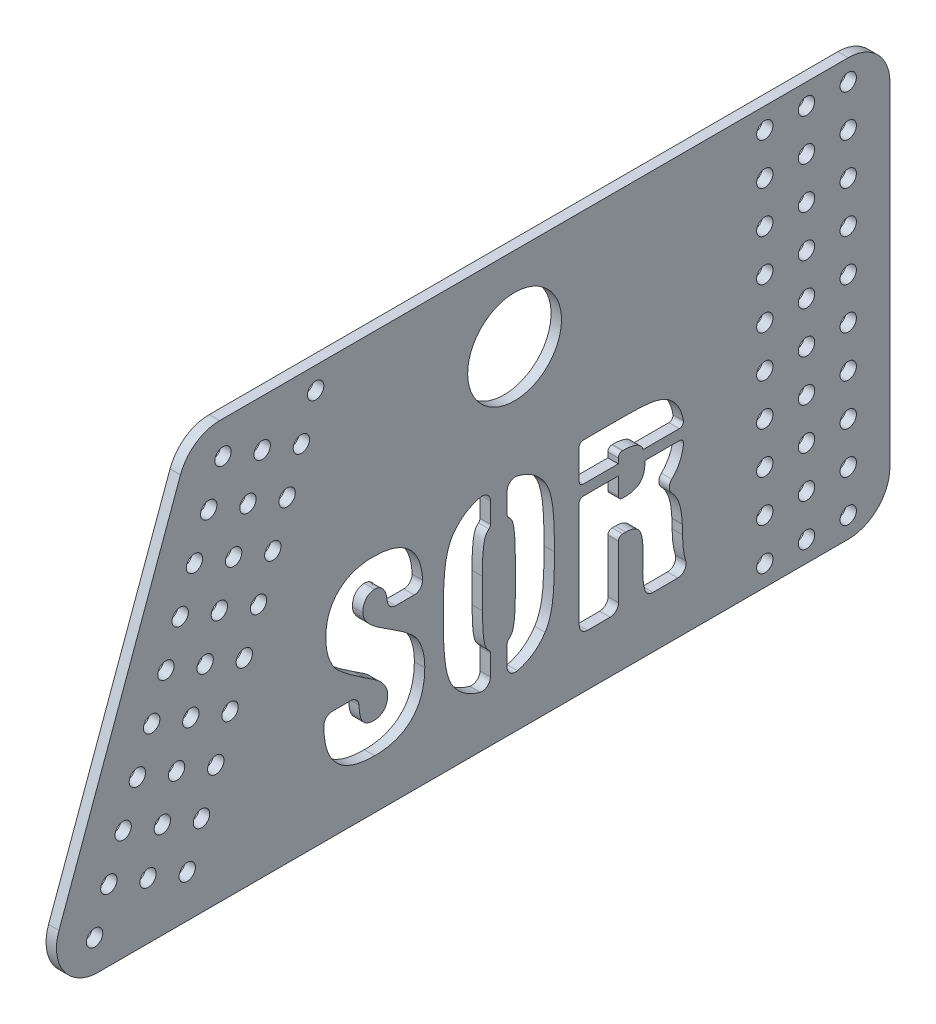
from build123d import *

# Parameters (mm, degrees)
SKETCH1_R           = 2.4892
BOSS_EXTRUDE1_DEPTH = 3.175
FILLET1_R           = 12.7
CUT_EXTRUDE3_DEPTH  = 289.68110898
FILLET2_START       = 17
FILLET2_OUTLINE_R   = 14.2875
FILLET2_DEPTH       = 5
FILLET2_START_2     = 17.71343226
FILLET2_2_DEPTH     = 3.175
FILLET3_R           = 1.27


with BuildPart() as part:
    # Sketch1 → Boss-Extrude1 (new body)
    with BuildSketch(Plane(origin=(17.71343226, 0, 0), x_dir=(0, 0, -1), z_dir=(1, 0, 0))):
        Polygon((46.224219752, 127), (0, 0), (259.225195644, 0), (259.225195644, 127), align=None)
        with Locations((17.043593575, 9.694572611)):
            Circle(SKETCH1_R, mode=Mode.SUBTRACT)
        with Locations((21.387249395, 21.628668895)):
            Circle(SKETCH1_R, mode=Mode.SUBTRACT)
        with Locations((33.321345679, 17.285013075)):
            Circle(SKETCH1_R, mode=Mode.SUBTRACT)
        with Locations((45.255441963, 12.941357254)):
            Circle(SKETCH1_R, mode=Mode.SUBTRACT)
        with Locations((49.599097783, 24.875453538)):
            Circle(SKETCH1_R, mode=Mode.SUBTRACT)
        with Locations((25.730905215, 33.562765179)):
            Circle(SKETCH1_R, mode=Mode.SUBTRACT)
        with Locations((30.074561035, 45.496861463)):
            Circle(SKETCH1_R, mode=Mode.SUBTRACT)
        with Locations((37.665001499, 29.219109359)):
            Circle(SKETCH1_R, mode=Mode.SUBTRACT)
        with Locations((53.942753603, 36.809549822)):
            Circle(SKETCH1_R, mode=Mode.SUBTRACT)
        with Locations((42.008657319, 41.153205642)):
            Circle(SKETCH1_R, mode=Mode.SUBTRACT)
        with Locations((58.286409424, 48.743646106)):
            Circle(SKETCH1_R, mode=Mode.SUBTRACT)
        with Locations((46.35231314, 53.087301926)):
            Circle(SKETCH1_R, mode=Mode.SUBTRACT)
        with Locations((34.418216856, 57.430957747)):
            Circle(SKETCH1_R, mode=Mode.SUBTRACT)
        with Locations((62.630065244, 60.67774239)):
            Circle(SKETCH1_R, mode=Mode.SUBTRACT)
        with Locations((38.761872676, 69.365054031)):
            Circle(SKETCH1_R, mode=Mode.SUBTRACT)
        with Locations((50.69596896, 65.02139821)):
            Circle(SKETCH1_R, mode=Mode.SUBTRACT)
        with Locations((43.105528496, 81.299150315)):
            Circle(SKETCH1_R, mode=Mode.SUBTRACT)
        with Locations((55.03962478, 76.955494494)):
            Circle(SKETCH1_R, mode=Mode.SUBTRACT)
        with Locations((59.3832806, 88.889590778)):
            Circle(SKETCH1_R, mode=Mode.SUBTRACT)
        with Locations((47.449184316, 93.233246599)):
            Circle(SKETCH1_R, mode=Mode.SUBTRACT)
        with Locations((63.726936421, 100.823687062)):
            Circle(SKETCH1_R, mode=Mode.SUBTRACT)
        with Locations((66.973721064, 72.611838674)):
            Circle(SKETCH1_R, mode=Mode.SUBTRACT)
        with Locations((71.317376884, 84.545934958)):
            Circle(SKETCH1_R, mode=Mode.SUBTRACT)
        with Locations((75.661032705, 96.480031242)):
            Circle(SKETCH1_R, mode=Mode.SUBTRACT)
        with Locations((221.125195644, 6.35)):
            Circle(SKETCH1_R, mode=Mode.SUBTRACT)
        with Locations((221.125195644, 19.05)):
            Circle(SKETCH1_R, mode=Mode.SUBTRACT)
        with Locations((233.825195644, 6.35)):
            Circle(SKETCH1_R, mode=Mode.SUBTRACT)
        with Locations((246.525195644, 6.35)):
            Circle(SKETCH1_R, mode=Mode.SUBTRACT)
        with Locations((233.825195644, 19.05)):
            Circle(SKETCH1_R, mode=Mode.SUBTRACT)
        with Locations((246.525195644, 19.05)):
            Circle(SKETCH1_R, mode=Mode.SUBTRACT)
        with Locations((221.125195644, 31.75)):
            Circle(SKETCH1_R, mode=Mode.SUBTRACT)
        with Locations((221.125195644, 44.45)):
            Circle(SKETCH1_R, mode=Mode.SUBTRACT)
        with Locations((233.825195644, 31.75)):
            Circle(SKETCH1_R, mode=Mode.SUBTRACT)
        with Locations((246.525195644, 31.75)):
            Circle(SKETCH1_R, mode=Mode.SUBTRACT)
        with Locations((233.825195644, 44.45)):
            Circle(SKETCH1_R, mode=Mode.SUBTRACT)
        with Locations((246.525195644, 44.45)):
            Circle(SKETCH1_R, mode=Mode.SUBTRACT)
        with Locations((221.125195644, 57.15)):
            Circle(SKETCH1_R, mode=Mode.SUBTRACT)
        with Locations((221.125195644, 69.85)):
            Circle(SKETCH1_R, mode=Mode.SUBTRACT)
        with Locations((233.825195644, 57.15)):
            Circle(SKETCH1_R, mode=Mode.SUBTRACT)
        with Locations((246.525195644, 57.15)):
            Circle(SKETCH1_R, mode=Mode.SUBTRACT)
        with Locations((233.825195644, 69.85)):
            Circle(SKETCH1_R, mode=Mode.SUBTRACT)
        with Locations((246.525195644, 69.85)):
            Circle(SKETCH1_R, mode=Mode.SUBTRACT)
        with Locations((221.125195644, 82.55)):
            Circle(SKETCH1_R, mode=Mode.SUBTRACT)
        with Locations((221.125195644, 95.25)):
            Circle(SKETCH1_R, mode=Mode.SUBTRACT)
        with Locations((233.825195644, 82.55)):
            Circle(SKETCH1_R, mode=Mode.SUBTRACT)
        with Locations((246.525195644, 82.55)):
            Circle(SKETCH1_R, mode=Mode.SUBTRACT)
        with Locations((233.825195644, 95.25)):
            Circle(SKETCH1_R, mode=Mode.SUBTRACT)
        with Locations((246.525195644, 95.25)):
            Circle(SKETCH1_R, mode=Mode.SUBTRACT)
        with Locations((51.792840137, 105.167342883)):
            Circle(SKETCH1_R, mode=Mode.SUBTRACT)
        with Locations((56.136495957, 117.101439167)):
            Circle(SKETCH1_R, mode=Mode.SUBTRACT)
        with Locations((68.070592241, 112.757783346)):
            Circle(SKETCH1_R, mode=Mode.SUBTRACT)
        with Locations((80.004688525, 108.414127526)):
            Circle(SKETCH1_R, mode=Mode.SUBTRACT)
        with Locations((84.348344345, 120.34822381)):
            Circle(SKETCH1_R, mode=Mode.SUBTRACT)
        with Locations((221.125195644, 107.95)):
            Circle(SKETCH1_R, mode=Mode.SUBTRACT)
        with Locations((221.125195644, 120.65)):
            Circle(SKETCH1_R, mode=Mode.SUBTRACT)
        with Locations((233.825195644, 107.95)):
            Circle(SKETCH1_R, mode=Mode.SUBTRACT)
        with Locations((246.525195644, 107.95)):
            Circle(SKETCH1_R, mode=Mode.SUBTRACT)
        with Locations((233.825195644, 120.65)):
            Circle(SKETCH1_R, mode=Mode.SUBTRACT)
        with Locations((246.525195644, 120.65)):
            Circle(SKETCH1_R, mode=Mode.SUBTRACT)
    extrude(amount=BOSS_EXTRUDE1_DEPTH)

    # Fillet1
    fillet1_edges = [part.edges().sort_by_distance(p)[0] for p in [
        (19.30093226, 0, -259.225195644),
        (19.30093226, 0, 0),
        (19.30093226, 127, -46.224219752),
        (19.30093226, 127, -259.225195644),
    ]]
    fillet(fillet1_edges, radius=FILLET1_R)

    # Sketch4 → Cut-Extrude3 (cut, through all)
    with BuildSketch(Plane.ZY.offset(-17.71343226)):
        with BuildLine():
            add(Edge.make_bspline(
                [(-102.346531748, 15.017852494), (-101.137761454, 15.009990472), (-99.374464661, 15.117696089), (-97.1266748, 15.528842731), (-95.606811505, 15.942503702), (-94.208407658, 16.49255363), (-92.922065326, 17.152816005), (-91.76611475, 17.953443404), (-90.728299578, 18.868938072), (-89.803929038, 19.901976312), (-89.022414939, 21.067741638), (-88.342858722, 22.340057391), (-87.810011199, 23.738015888), (-87.382607526, 25.248755736), (-86.969843115, 27.487068323), (-86.851218194, 29.24222061), (-86.856637214, 30.444948203)],
                knots=[0, 0, 0, 0, 0.144706603, 0.210732583, 0.273247813, 0.332929474, 0.390291493, 0.445929998, 0.500771491, 0.555612984, 0.611353057, 0.668368911, 0.727908241, 0.790046978, 0.856072958, 1, 1, 1, 1], degree=3))
            add(Edge.make_bspline(
                [(-86.856637214, 30.444948203), (-86.850277593, 30.784807967), (-86.860814621, 31.228846126), (-86.870633478, 31.801094773), (-86.925686599, 32.371628198), (-86.936455989, 32.840101462), (-86.969542836, 33.179173546)],
                knots=[0, 0, 0, 0, 0.372291137, 0.486887781, 0.626896694, 1, 1, 1, 1], degree=3))
            Line((-86.969542836, 33.179173546), (-97.513663145, 33.197248797))
            Line((-97.513663145, 33.197248797), (-97.516115735, 31.766541022))
            add(Edge.make_bspline(
                [(-97.516115735, 31.766541022), (-97.518703085, 31.141877778), (-97.553412891, 30.242586883), (-97.653779838, 29.094530251), (-97.781864596, 28.348508983), (-97.90450162, 27.668177474), (-98.102879225, 27.071449283), (-98.298940533, 26.536348737), (-98.624339582, 25.942049729), (-99.139689425, 25.316707469), (-100.282944801, 24.567304596), (-101.349541392, 24.43603042), (-102.056022818, 24.424775719)],
                knots=[0, 0, 0, 0, 0.189473721, 0.273111235, 0.349375655, 0.419162021, 0.48249029, 0.539920022, 0.591813841, 0.687504397, 0.782623415, 1, 1, 1, 1], degree=3))
            add(Edge.make_bspline(
                [(-102.056022818, 24.424775719), (-102.653560847, 24.425432252), (-103.541158477, 24.557505805), (-104.563566575, 25.107854352), (-105.187521658, 25.670442659), (-105.690365722, 26.365695614), (-106.196679819, 27.502959934), (-106.303309834, 28.469693053), (-106.300902157, 29.125963718)],
                knots=[0, 0, 0, 0, 0.251446371, 0.366612785, 0.482014955, 0.600589513, 0.723754341, 1, 1, 1, 1], degree=3))
            add(Edge.make_bspline(
                [(-106.300902157, 29.125963718), (-106.31327283, 29.73434108), (-106.111599903, 30.653013303), (-105.560384679, 31.801651052), (-104.982263104, 32.674332259), (-104.224468554, 33.520330627), (-102.951996407, 34.702651096), (-101.829150462, 35.477149524), (-101.026882379, 35.976500714)],
                knots=[0, 0, 0, 0, 0.201131267, 0.308106748, 0.422671857, 0.548244122, 0.685138631, 1, 1, 1, 1], degree=3))
            add(Edge.make_bspline(
                [(-101.026882379, 35.976500714), (-100.382721085, 36.426731384), (-99.712288751, 36.836594118)],
                knots=[0, 0, 0, 1, 1, 1], degree=2))
            add(Edge.make_bspline(
                [(-99.712288751, 36.836594118), (-99.421578607, 37.007529941), (-99.143303842, 37.19819643)],
                knots=[0, 0, 0, 1, 1, 1], degree=2))
            add(Edge.make_bspline(
                [(-99.143303842, 37.19819643), (-98.02634731, 37.917546811), (-96.459324724, 38.994367569), (-94.496194334, 40.398978438), (-93.280265294, 41.34075421), (-92.227480657, 42.195382991), (-91.139681231, 43.164971045), (-90.439481771, 43.888639151), (-90.076340575, 44.385210274)],
                knots=[0, 0, 0, 0, 0.343185346, 0.491233736, 0.623581222, 0.740501597, 0.841497893, 1, 1, 1, 1], degree=3))
            add(Edge.make_bspline(
                [(-90.076340575, 44.385210274), (-89.645084495, 45.001125589), (-89.077498156, 45.988251431), (-88.475097151, 47.39365682), (-88.101922741, 48.514339009), (-87.804372631, 49.689122272), (-87.527205457, 51.360362924), (-87.439276662, 52.648633655), (-87.444236178, 53.523535699)],
                knots=[0, 0, 0, 0, 0.23336578, 0.352452206, 0.474357131, 0.59983969, 0.728425053, 1, 1, 1, 1], degree=3))
            add(Edge.make_bspline(
                [(-87.444236178, 53.523535699), (-87.43140053, 54.570872505), (-87.558921522, 56.102940046), (-87.945368253, 58.070314371), (-88.368953671, 59.41885791), (-88.903618876, 60.685028319), (-89.571901763, 61.852805259), (-90.352509885, 62.937175762), (-91.250275623, 63.926219676), (-92.259482183, 64.810650193), (-93.365490302, 65.578712543), (-94.553878491, 66.246911322), (-95.843151701, 66.771408062), (-97.216236789, 67.190101773), (-99.215900094, 67.589628065), (-100.779482055, 67.697129642), (-101.844649221, 67.698551029)],
                knots=[0, 0, 0, 0, 0.137036202, 0.200811447, 0.26225021, 0.321860438, 0.380504602, 0.438104572, 0.496561124, 0.555086537, 0.613485121, 0.672665356, 0.733292709, 0.795423374, 0.860456494, 1, 1, 1, 1], degree=3))
            add(Edge.make_bspline(
                [(-101.844649221, 67.698551029), (-102.99721851, 67.698535447), (-104.682473904, 67.604476919), (-106.835661346, 67.204803551), (-108.298380806, 66.800851704), (-109.652713032, 66.271806446), (-110.897263041, 65.625523019), (-112.033822811, 64.859007473), (-113.058420384, 63.975998143), (-113.968063775, 62.980839357), (-114.7588024, 61.876553797), (-115.426402063, 60.665597224), (-115.982307468, 59.354625781), (-116.405426951, 57.935247839), (-116.800659766, 55.842151404), (-116.929754633, 54.205987194), (-116.921576005, 53.084097351)],
                knots=[0, 0, 0, 0, 0.144329262, 0.210477526, 0.27376446, 0.333965646, 0.39211498, 0.448922421, 0.505148783, 0.561000861, 0.617268822, 0.674725679, 0.733721037, 0.795158799, 0.859700873, 1, 1, 1, 1], degree=3))
            add(Edge.make_bspline(
                [(-116.921576005, 53.084097351), (-116.924223152, 52.805750917), (-116.874198524, 52.251737781), (-116.862643079, 51.695787439), (-116.855836182, 51.418087147)],
                knots=[0, 0, 0, 0, 0.500152825, 1, 1, 1, 1], degree=3))
            Line((-116.855836182, 51.418087147), (-106.262719031, 51.399927904))
            Line((-106.262719031, 51.399927904), (-106.261627124, 52.036886844))
            add(Edge.make_bspline(
                [(-106.261627124, 52.036886844), (-106.272938869, 53.034959826), (-106.165304258, 54.4455779), (-105.735577795, 56.160455263), (-105.292743149, 57.152021009), (-104.731481922, 57.938536315), (-103.80710129, 58.713452985), (-102.916022676, 58.933951856), (-102.33007041, 58.919123348)],
                knots=[0, 0, 0, 0, 0.338075787, 0.476571748, 0.596906439, 0.70380763, 0.801284768, 1, 1, 1, 1], degree=3))
            add(Edge.make_bspline(
                [(-102.33007041, 58.919123348), (-101.829228288, 58.91602755), (-101.0766223, 58.780935321), (-100.224872779, 58.252454139), (-99.69076936, 57.720027131), (-99.256184908, 57.06227906), (-98.82557709, 56.00639931), (-98.726094574, 55.123361987), (-98.731428624, 54.522824471)],
                knots=[0, 0, 0, 0, 0.236687534, 0.34842468, 0.466860105, 0.588743967, 0.716870172, 1, 1, 1, 1], degree=3))
            add(Edge.make_bspline(
                [(-98.731428624, 54.522824471), (-98.727994288, 53.95374318), (-98.94822206, 53.083351344), (-99.550197411, 52.001121159), (-100.190143623, 51.148533103), (-100.998027468, 50.27444182), (-102.415651738, 49.056826954), (-103.617067639, 48.204609416), (-104.495433617, 47.663328035)],
                knots=[0, 0, 0, 0, 0.182289154, 0.284139561, 0.397956908, 0.525486442, 0.667349445, 1, 1, 1, 1], degree=3))
            add(Edge.make_bspline(
                [(-104.495433617, 47.663328035), (-104.799813267, 47.451733387), (-105.350939129, 47.122460298), (-105.874612504, 46.751439244), (-106.104344265, 46.607751221)],
                knots=[0, 0, 0, 0, 0.577693413, 1, 1, 1, 1], degree=3))
            add(Edge.make_bspline(
                [(-106.104344265, 46.607751221), (-106.760254865, 46.223456768), (-107.389455795, 45.796604262)],
                knots=[0, 0, 0, 1, 1, 1], degree=2))
            add(Edge.make_bspline(
                [(-107.389455795, 45.796604262), (-108.346725757, 45.201275361), (-109.703619472, 44.31047015), (-111.393959277, 43.107292253), (-112.449588017, 42.261805131), (-113.383644145, 41.473966654), (-114.367063078, 40.512703342), (-115.014104016, 39.787390642), (-115.338148772, 39.274032428)],
                knots=[0, 0, 0, 0, 0.326827235, 0.470629277, 0.601394131, 0.718923834, 0.824753266, 1, 1, 1, 1], degree=3))
            add(Edge.make_bspline(
                [(-115.338148772, 39.274032428), (-115.706092343, 38.686367366), (-116.192760735, 37.752942834), (-116.70538865, 36.425944857), (-117.012653825, 35.358730514), (-117.274733926, 34.245470648), (-117.51192481, 32.664814674), (-117.582794216, 31.450068901), (-117.587237877, 30.625020275)],
                knots=[0, 0, 0, 0, 0.229662467, 0.347870699, 0.470840235, 0.597411334, 0.726621142, 1, 1, 1, 1], degree=3))
            add(Edge.make_bspline(
                [(-117.587237877, 30.625020275), (-117.592435155, 29.445933011), (-117.490650914, 27.716686691), (-117.066544357, 25.512127044), (-116.639479334, 24.006566878), (-116.081218972, 22.611357603), (-115.410594631, 21.316099316), (-114.597816254, 20.137572604), (-113.668698852, 19.06871301), (-112.627254207, 18.10594707), (-111.465523195, 17.28223145), (-110.204762441, 16.580571453), (-108.839465748, 16.005120514), (-107.36441651, 15.564202465), (-105.198160865, 15.139696248), (-103.504528459, 15.006275151), (-102.346531748, 15.017852494)],
                knots=[0, 0, 0, 0, 0.142387442, 0.20826911, 0.270660411, 0.330990701, 0.3893684, 0.446348619, 0.503357479, 0.560009359, 0.617119025, 0.67483118, 0.733852434, 0.795598798, 0.86031991, 1, 1, 1, 1], degree=3))
        make_face()
        with BuildLine():
            add(Edge.make_bspline(
                [(-135.137111808, 36.827482877), (-135.138911136, 35.585710284), (-135.177577725, 33.818356076), (-135.274659936, 31.589080402), (-135.412960716, 30.208411693), (-135.549858935, 29.01602692), (-135.738543858, 28.015364231), (-135.942327716, 27.197346068), (-136.201862948, 26.54847353), (-136.52249732, 26.041175054), (-136.877189591, 25.610100095), (-137.242131867, 25.30273949), (-137.485464149, 25.140626536), (-137.580645931, 25.083265084)],
                knots=[0, 0, 0, 0, 0.246099497, 0.350474793, 0.442158792, 0.52110539, 0.588285913, 0.643883824, 0.688013345, 0.726105642, 0.762417351, 0.798234999, 0.820247331, 0.820247331, 0.820247331, 0.820247331], degree=3))
            Line((-137.580645931, 25.083265084), (-137.580645931, 15.169480081))
            add(Edge.make_bspline(
                [(-137.580645931, 15.16948008), (-136.925112896, 15.237183354), (-135.582639213, 15.434461701), (-133.617682661, 15.896270515), (-131.755507316, 16.615084184), (-130.063737661, 17.541838734), (-128.027038904, 19.071938936), (-126.764482306, 20.524062042), (-126.069386172, 21.593474816)],
                knots=[0.160645262, 0.160645262, 0.160645262, 0.160645262, 0.282125908, 0.410512069, 0.531963987, 0.648948724, 0.765055946, 1, 1, 1, 1], degree=3))
            add(Edge.make_bspline(
                [(-126.069386172, 21.593474816), (-125.49783603, 22.458096729), (-124.85997275, 23.973989075), (-124.23671347, 26.194185514), (-123.927268025, 27.818725075), (-123.718473589, 29.279012914), (-123.599078976, 30.554958284), (-123.470314539, 31.981271219), (-123.391284792, 33.563526449), (-123.301892709, 35.297354206), (-123.238274495, 37.914138942), (-123.214028109, 39.952499361), (-123.213268603, 41.363762096)],
                knots=[0, 0, 0, 0, 0.153165915, 0.242870067, 0.342209598, 0.398542505, 0.461930228, 0.532521544, 0.611241583, 0.697205761, 0.790391521, 1, 1, 1, 1], degree=3))
            add(Edge.make_bspline(
                [(-123.213268603, 41.363762096), (-123.209232207, 42.775016696), (-123.226371267, 44.813455074), (-123.28119123, 47.430432575), (-123.36406097, 49.161323089), (-123.439042733, 50.743754382), (-123.561657242, 52.170573696), (-123.67614615, 53.447040249), (-123.883077862, 54.90754049), (-124.183034181, 56.533805682), (-124.800777183, 58.759002908), (-125.432819651, 60.277181197), (-126.001587185, 61.143725346)],
                knots=[0, 0, 0, 0, 0.20960954, 0.302795771, 0.388760385, 0.466996393, 0.538071606, 0.601459649, 0.657312329, 0.757128703, 0.84683331, 1, 1, 1, 1], degree=3))
            add(Edge.make_bspline(
                [(-126.001587185, 61.143725346), (-126.694287438, 62.219759114), (-127.945575146, 63.689270023), (-129.979905901, 65.229057536), (-131.671090664, 66.152648427), (-133.533917697, 66.861050436), (-135.520514738, 67.358188126), (-136.894708397, 67.551630609), (-137.580645931, 67.617547346)],
                knots=[0, 0, 0, 0, 0.235743144, 0.351796653, 0.468437187, 0.589616336, 0.718088431, 0.844990788, 0.844990788, 0.844990788, 0.844990788], degree=3))
            Line((-137.580645931, 67.617547346), (-137.580645931, 57.75293648))
            Line((-137.580645931, 57.75293648), (-137.580645931, 57.747988238))
            add(Edge.make_bspline(
                [(-137.580645931, 57.747988238), (-137.462455054, 57.680661445), (-137.195029858, 57.510173458), (-136.817398976, 57.183369592), (-136.458310187, 56.765123611), (-136.153238779, 56.25957781), (-135.8921474, 55.623772935), (-135.692966662, 54.813644099), (-135.505381838, 53.816160553), (-135.375066925, 52.619551665), (-135.240900608, 51.228747564), (-135.151386984, 48.979517719), (-135.119142331, 47.195737504), (-135.121489147, 45.940895413)],
                knots=[0.172928377, 0.172928377, 0.172928377, 0.172928377, 0.199876863, 0.235721816, 0.27156677, 0.308796515, 0.352361395, 0.407375581, 0.473970392, 0.553620279, 0.646019442, 0.7511215, 1, 1, 1, 1], degree=3))
            Line((-135.121489147, 45.940895413), (-135.137111808, 36.827482877))
        make_face()
        with BuildLine():
            add(Edge.make_bspline(
                [(-142.660656289, 25.014245558), (-142.793326062, 25.088372236), (-143.073107477, 25.265224404), (-143.469229479, 25.591831868), (-143.824416544, 26.011278135), (-144.130839945, 26.515846915), (-144.388813751, 27.153582898), (-144.605674121, 27.963134837), (-144.78430421, 28.966857287), (-144.922495914, 30.165260027), (-145.035071959, 31.557844925), (-145.156150132, 33.804996532), (-145.165571531, 35.590367409), (-145.171664965, 36.844684602)],
                knots=[0.168940196, 0.168940196, 0.168940196, 0.168940196, 0.199078, 0.234523767, 0.270388048, 0.307637868, 0.351226239, 0.406441644, 0.473709631, 0.553402467, 0.6457946, 0.750987302, 1, 1, 1, 1], degree=3))
            Line((-145.171664965, 36.844684602), (-145.156042304, 45.958097138))
            add(Edge.make_bspline(
                [(-145.156042304, 45.958097138), (-145.144616681, 47.225339112), (-145.131730536, 49.02728688), (-144.999637708, 51.293214328), (-144.88880394, 52.693215429), (-144.728478904, 53.89239752), (-144.552063835, 54.893838397), (-144.329200397, 55.695102291), (-144.072241348, 56.326265387), (-143.751065174, 56.814405215), (-143.392296647, 57.224638456), (-143.02365539, 57.53285447), (-142.767249036, 57.689544226), (-142.660656289, 57.747619787)],
                knots=[0, 0, 0, 0, 0.251020298, 0.356614174, 0.449435963, 0.529024965, 0.596136496, 0.65060096, 0.693492176, 0.730452155, 0.765744421, 0.801107745, 0.825115342, 0.825115342, 0.825115342, 0.825115342], degree=3))
            Line((-142.660656289, 57.747619787), (-142.660656289, 57.752567994))
            Line((-142.660656289, 57.752567994), (-142.660656289, 67.623818278))
            add(Edge.make_bspline(
                [(-142.660656289, 67.623818278), (-143.340702931, 67.560948326), (-144.70322248, 67.374742657), (-146.672265396, 66.883465753), (-148.518041503, 66.181421509), (-150.193222169, 65.263601215), (-152.210834134, 63.723856064), (-153.45789011, 62.262275201), (-154.155172361, 61.191987609)],
                knots=[0.157908832, 0.157908832, 0.157908832, 0.157908832, 0.284112286, 0.411868146, 0.532349162, 0.648344483, 0.763846436, 1, 1, 1, 1], degree=3))
            add(Edge.make_bspline(
                [(-154.155172361, 61.191987609), (-154.739425945, 60.316993198), (-155.421016847, 58.799318782), (-156.059552589, 56.560159652), (-156.363444147, 54.933785982), (-156.575739732, 53.474052416), (-156.693932274, 52.201192054), (-156.822522337, 50.778161651), (-156.902277702, 49.199207726), (-156.991239466, 47.468624174), (-157.054756434, 44.858375054), (-157.079209413, 42.826548667), (-157.079885509, 41.421817919)],
                knots=[0, 0, 0, 0, 0.155519152, 0.245246631, 0.344941287, 0.400725859, 0.464036605, 0.534542197, 0.612682802, 0.698542588, 0.791615186, 1, 1, 1, 1], degree=3))
            add(Edge.make_bspline(
                [(-157.079885509, 41.421817919), (-157.083874365, 40.020360601), (-157.066626825, 37.994992158), (-157.011983508, 35.394336671), (-156.928632499, 33.670005974), (-156.854516467, 32.094053433), (-156.731040207, 30.67055067), (-156.61607481, 29.394201169), (-156.41150378, 27.930044855), (-156.107703619, 26.294170043), (-155.486881562, 24.043488171), (-154.802629175, 22.519167985), (-154.222971349, 21.641737079)],
                knots=[0, 0, 0, 0, 0.207908774, 0.300500752, 0.385879955, 0.464023771, 0.53453226, 0.597845608, 0.654112418, 0.75381117, 0.844474458, 1, 1, 1, 1], degree=3))
            add(Edge.make_bspline(
                [(-154.222971349, 21.641737079), (-153.549202365, 20.563895586), (-152.297141864, 19.120243227), (-150.289403311, 17.570726281), (-148.60230986, 16.644758686), (-146.749172277, 15.921341504), (-144.746336762, 15.43957588), (-143.363790984, 15.226776331), (-142.660656289, 15.154146904)],
                knots=[0, 0, 0, 0, 0.234552485, 0.350071381, 0.467433479, 0.589277168, 0.716904566, 0.84765444, 0.84765444, 0.84765444, 0.84765444], degree=3))
            Line((-142.660656289, 15.154146904), (-142.660656289, 25.014245558))
        make_face()
        with BuildLine():
            add(Edge.make_bspline(
                [(-177.963828927, 57.729411488), (-177.72790771, 57.729645213), (-177.239603212, 57.677746875), (-176.74884757, 57.665766191), (-176.494041269, 57.658296126)],
                knots=[0, 0, 0, 0, 0.480233968, 1, 1, 1, 1], degree=3))
            Line((-176.494041269, 57.658296126), (-176.498764486, 54.903027551))
            Line((-176.498764486, 54.903027551), (-164.582697595, 54.903027551))
            Line((-164.582697595, 54.903027551), (-164.572351082, 66.486714972))
            Line((-164.572351082, 66.486714972), (-177.987974891, 66.509712695))
            add(Edge.make_bspline(
                [(-177.987974891, 66.509712695), (-179.000647169, 66.511126573), (-180.46461378, 66.498514527), (-182.342806279, 66.434170672), (-183.584693069, 66.370907606), (-184.714596429, 66.28015439), (-185.732700742, 66.19324181), (-186.637944907, 66.065130684), (-187.676396863, 65.877353957), (-188.845024666, 65.578803882), (-190.503980558, 64.979736185), (-191.62043272, 64.334750929), (-192.260525161, 63.809947006)],
                knots=[0, 0, 0, 0, 0.205396664, 0.296881476, 0.38114652, 0.45756683, 0.526784472, 0.588339837, 0.642914613, 0.74077175, 0.832579827, 1, 1, 1, 1], degree=3))
            add(Edge.make_bspline(
                [(-192.260525161, 63.809947006), (-192.967910621, 63.224976919), (-193.916174958, 62.215461216), (-194.924447982, 60.668133656), (-195.521406307, 59.388941727), (-196.000727706, 58.005422568), (-196.331699064, 56.497481138), (-196.45640485, 55.446678295), (-196.499339595, 54.903027551)],
                knots=[0, 0, 0, 0, 0.231227889, 0.346863356, 0.464425679, 0.586358231, 0.715485013, 0.852963723, 0.852963723, 0.852963723, 0.852963723], degree=3))
            Line((-196.499339595, 54.903027551), (-184.123399875, 54.903027551))
            add(Edge.make_bspline(
                [(-184.123399875, 54.903027551), (-184.02960663, 55.130368213), (-183.852527565, 55.517580369), (-183.495565102, 55.995810545), (-183.137056234, 56.37845924), (-182.717659932, 56.706147338), (-182.229028261, 56.978745645), (-181.678609864, 57.209597114), (-181.063537087, 57.409737203), (-180.37865876, 57.54725591), (-179.341310631, 57.695163844), (-178.526708945, 57.736396317), (-177.963828927, 57.729411488)],
                knots=[0.309911832, 0.309911832, 0.309911832, 0.309911832, 0.38014834, 0.430984798, 0.479895591, 0.529804757, 0.582537959, 0.63946694, 0.700338876, 0.767231212, 0.838985026, 1, 1, 1, 1], degree=3))
        make_face()
        with BuildLine():
            Line((-164.585542878, 51.717522125), (-176.504225237, 51.717522125))
            Line((-176.504225237, 51.717522125), (-176.515308246, 45.252295836))
            add(Edge.make_bspline(
                [(-176.515308246, 45.252295836), (-176.770915336, 45.256028277), (-177.259473109, 45.206490919), (-177.750089935, 45.193598571), (-177.985331084, 45.186220042)],
                knots=[0, 0, 0, 0, 0.520157243, 1, 1, 1, 1], degree=3))
            add(Edge.make_bspline(
                [(-177.985331084, 45.186220042), (-178.550258857, 45.167387719), (-179.360700135, 45.244483855), (-180.402679908, 45.378975985), (-181.082123963, 45.550921775), (-181.704204044, 45.752085691), (-182.245812445, 46.023262758), (-182.740423162, 46.312711543), (-183.154135084, 46.674445912), (-183.514526746, 47.087820341), (-183.828568561, 47.557049699), (-184.080315247, 48.098995218), (-184.296684, 48.698505956), (-184.458925006, 49.366037407), (-184.61419945, 50.376550843), (-184.671780533, 51.168880421), (-184.657329234, 51.717522125)],
                knots=[0, 0, 0, 0, 0.155118411, 0.224207996, 0.289017523, 0.347911711, 0.403845181, 0.455536758, 0.505305623, 0.554394877, 0.606297425, 0.660219325, 0.718561151, 0.781623537, 0.849070932, 1, 1, 1, 1], degree=3))
            Line((-184.657329234, 51.717522125), (-196.527449922, 51.717522125))
            add(Edge.make_bspline(
                [(-196.527449922, 51.717522125), (-196.475201941, 50.837952617), (-196.300408407, 49.353996151), (-195.768759005, 47.352461233), (-195.089791716, 45.740569588), (-194.207755497, 44.28613323), (-192.724828253, 42.501303004), (-191.311404634, 41.429830894), (-190.291064077, 40.817185228)],
                knots=[0.098766619, 0.098766619, 0.098766619, 0.098766619, 0.280055924, 0.405539965, 0.52398272, 0.638998927, 0.754578273, 1, 1, 1, 1], degree=3))
            add(Edge.make_bspline(
                [(-190.291064077, 40.817185228), (-191.176718428, 40.432138702), (-192.390292561, 39.587479232), (-193.668439846, 38.075152494), (-194.453404101, 36.717597237), (-195.095389085, 35.168220658), (-195.749371017, 32.704414488), (-195.922365704, 30.71347284), (-195.984603044, 29.332252558)],
                knots=[0, 0, 0, 0, 0.213379373, 0.322303622, 0.436541125, 0.559567263, 0.69304435, 1, 1, 1, 1], degree=3))
            add(Edge.make_bspline(
                [(-195.984603044, 29.332252558), (-195.984745831, 29.248957927), (-195.984888619, 29.165663296)],
                knots=[0, 0, 0, 1, 1, 1], degree=2))
            add(Edge.make_bspline(
                [(-195.984888619, 29.165663296), (-195.998825313, 28.780286181), (-196.041848012, 27.866134984), (-196.034065358, 26.950821413), (-196.058187794, 26.421957757)],
                knots=[0, 0, 0, 0, 0.4215247, 1, 1, 1, 1], degree=3))
            add(Edge.make_bspline(
                [(-196.058187794, 26.421957757), (-196.081918599, 25.132439413), (-196.183086455, 23.290045966), (-196.53368872, 20.981539929), (-196.879171675, 19.543875507), (-197.29035376, 18.294077996), (-197.952622051, 16.967543399), (-198.60515745, 16.134500824), (-199.143700508, 15.74590424)],
                knots=[0, 0, 0, 0, 0.338502968, 0.483368223, 0.612054936, 0.72616928, 0.827749229, 1, 1, 1, 1], degree=3))
            Line((-199.143700508, 15.74590424), (-185.26779497, 15.72211748))
            add(Edge.make_bspline(
                [(-185.26779497, 15.72211748), (-184.809134871, 16.769011033), (-184.130448764, 19.055196087), (-183.957458701, 21.431563977), (-183.952585603, 22.65783604)],
                knots=[0, 0, 0, 0, 0.481906591, 1, 1, 1, 1], degree=3))
            add(Edge.make_bspline(
                [(-183.952585603, 22.65783604), (-183.96594732, 23.627983058), (-183.974136061, 24.860165674), (-184.03578258, 26.303207472), (-184.049872071, 27.048277415), (-184.080760627, 27.531287699), (-184.071158148, 27.802722788)],
                knots=[0, 0, 0, 0, 0.565629876, 0.718062135, 0.841884928, 1, 1, 1, 1], degree=3))
            add(Edge.make_bspline(
                [(-184.071158148, 27.802722788), (-184.06318856, 28.508364569), (-184.044071897, 29.523848401), (-183.920415113, 30.813800652), (-183.794811267, 31.64877255), (-183.627274815, 32.391082965), (-183.434742235, 33.046060432), (-183.197823739, 33.606337331), (-182.931118408, 34.091144182), (-182.610798478, 34.501981885), (-182.234245968, 34.846741995), (-181.800484961, 35.131954994), (-181.317706569, 35.382386635), (-180.767487765, 35.562016149), (-179.931195043, 35.733985383), (-179.27042877, 35.779139553), (-178.814805271, 35.780220737)],
                knots=[0, 0, 0, 0, 0.190949899, 0.274374801, 0.350341988, 0.419144094, 0.480070736, 0.534709648, 0.583364094, 0.629312448, 0.674954022, 0.7207748, 0.769373068, 0.821616793, 0.876718002, 1, 1, 1, 1], degree=3))
            Line((-178.814805271, 35.780220737), (-176.531552453, 35.776306673))
            Line((-176.531552453, 35.776306673), (-176.565955904, 15.707200358))
            Line((-176.565955904, 15.707200358), (-164.617725478, 15.686718113))
            Line((-164.617725478, 15.686718113), (-164.585542878, 51.717522125))
        make_face()
    extrude(amount=-CUT_EXTRUDE3_DEPTH, mode=Mode.SUBTRACT)

    # Fillet2: read off the stored shape, not the designer's step
    # Fillet2 outline → Fillet2 (cut)
    with BuildSketch(Plane.YZ.offset(FILLET2_START)):
        with Locations((101.6, -144.925195644)):
            Circle(FILLET2_OUTLINE_R)
        with BuildLine():
            add(Edge.make_bspline(
                [(40.817185228, -190.291064077), (40.432138702, -191.176718428), (39.849749522, -192.013472729), (39.138093223, -192.721914192), (39.109558431, -192.74991402)],
                knots=[0, 0, 0, 0, 0.213379373, 0.222227002, 0.222227002, 0.222227002, 0.222227002], degree=3))
            ThreePointArc((39.109558431, -192.74991402), (40.923206191, -192.023116042), (42.716338065, -192.799151852))
            add(Edge.make_bspline(
                [(42.716338065, -192.799151852), (41.986734249, -192.043041693), (41.357013177, -191.190129199), (40.817185228, -190.291064077)],
                knots=[0.783748559, 0.783748559, 0.783748559, 0.783748559, 1, 1, 1, 1], degree=3))
        make_face()
    extrude(amount=FILLET2_DEPTH, mode=Mode.SUBTRACT)

    # Fillet2 2 outline → Fillet2 2 (add)
    with BuildSketch(Plane.YZ.offset(FILLET2_START_2)):
        with BuildLine():
            add(Edge.make_bspline(
                [(30.631131696, -86.854497161), (30.908836508, -86.85316383), (31.290913198, -86.861879591), (31.801094773, -86.870633478), (32.371628198, -86.925686599), (32.840101462, -86.936455989), (33.179173546, -86.969542836)],
                knots=[0.067994293, 0.067994293, 0.067994293, 0.067994293, 0.372291137, 0.486887781, 0.626896694, 1, 1, 1, 1], degree=3))
            ThreePointArc((30.631131696, -86.854497161), (32.43351739, -87.592575149), (33.183323008, -89.390113699))
            Line((33.183323008, -89.390113699), (33.179173546, -86.969542836))
        make_face()
        with BuildLine():
            Line((33.197248797, -97.513663145), (33.192934177, -94.996748096))
            ThreePointArc((33.192934177, -94.996748096), (32.486989268, -96.758331811), (30.757205172, -97.53896129))
            add(Edge.make_bspline(
                [(31.766541022, -97.516115735), (31.429865776, -97.517510241), (31.093414487, -97.525148219), (30.757205172, -97.53896129)],
                knots=[0, 0, 0, 0, 0.102120802, 0.102120802, 0.102120802, 0.102120802], degree=3))
            Line((31.766541022, -97.516115735), (33.197248797, -97.513663145))
        make_face()
        with BuildLine():
            Line((51.399927904, -106.262719031), (51.404151426, -108.726492609))
            ThreePointArc((51.404151426, -108.726492609), (52.062484007, -107.015990196), (53.700561589, -106.19384536))
            add(Edge.make_bspline(
                [(52.036886844, -106.261627124), (52.59198451, -106.267918371), (53.14788859, -106.24709214), (53.700561589, -106.19384536)],
                knots=[0, 0, 0, 0, 0.188027413, 0.188027413, 0.188027413, 0.188027413], degree=3))
            Line((52.036886844, -106.261627124), (51.399927904, -106.262719031))
        make_face()
        with BuildLine():
            ThreePointArc((54.05943645, -116.904679177), (52.197080722, -116.201392731), (51.413827913, -114.371229973))
            Line((51.413827913, -114.371229973), (51.418087147, -116.855836182))
            add(Edge.make_bspline(
                [(53.084097351, -116.921576005), (52.805750917, -116.924223152), (52.251737781, -116.874198524), (51.695787439, -116.862643079), (51.418087147, -116.855836182)],
                knots=[0, 0, 0, 0, 0.500152825, 1, 1, 1, 1], degree=3))
            add(Edge.make_bspline(
                [(54.05943645, -116.904679177), (53.734606717, -116.918197169), (53.409404748, -116.923947511), (53.084097351, -116.921576005)],
                knots=[0.959318338, 0.959318338, 0.959318338, 0.959318338, 1, 1, 1, 1], degree=3))
        make_face()
        with BuildLine():
            add(Edge.make_bspline(
                [(67.067927171, -134.403858573), (67.164913001, -134.778358367), (67.40153329, -135.828433913), (67.551630609, -136.894708397), (67.617547346, -137.580645931)],
                knots=[0.646838759, 0.646838759, 0.646838759, 0.646838759, 0.718088431, 0.844990788, 0.844990788, 0.844990788, 0.844990788], degree=3))
            ThreePointArc((67.067927171, -134.403858573), (66.617656381, -136.595342061), (64.609044934, -137.580645931))
            Line((64.609044934, -137.580645931), (67.617547346, -137.580645931))
        make_face()
        with BuildLine():
            ThreePointArc((18.183252094, -137.580645931), (16.178612621, -136.600460211), (15.721153453, -134.416410172))
            add(Edge.make_bspline(
                [(15.16948008, -137.580645931), (15.237183354, -136.925112896), (15.393078212, -135.864252708), (15.619837316, -134.816019324), (15.721153453, -134.416410172)],
                knots=[0.160645262, 0.160645262, 0.160645262, 0.160645262, 0.282125908, 0.35809699, 0.35809699, 0.35809699, 0.35809699], degree=3))
            Line((15.16948008, -137.580645931), (18.183252094, -137.580645931))
        make_face()
        with BuildLine():
            Line((67.623818278, -142.660656289), (64.621740228, -142.660656289))
            ThreePointArc((64.621740228, -142.660656289), (66.630968134, -143.646756928), (67.080116573, -145.839393909))
            add(Edge.make_bspline(
                [(67.623818278, -142.660656289), (67.560948326, -143.340702931), (67.41509665, -144.407940901), (67.179057927, -145.458587963), (67.080116573, -145.839393909)],
                knots=[0.157908832, 0.157908832, 0.157908832, 0.157908832, 0.284112286, 0.356830765, 0.356830765, 0.356830765, 0.356830765], degree=3))
        make_face()
        with BuildLine():
            add(Edge.make_bspline(
                [(15.70790839, -145.819117357), (15.619651119, -145.467556523), (15.389651302, -144.421979803), (15.226776331, -143.363790984), (15.154146904, -142.660656289)],
                knots=[0.649894666, 0.649894666, 0.649894666, 0.649894666, 0.716904566, 0.84765444, 0.84765444, 0.84765444, 0.84765444], degree=3))
            ThreePointArc((15.70790839, -145.819117357), (16.168654516, -143.638492904), (18.171463932, -142.660656289))
            Line((18.171463932, -142.660656289), (15.154146904, -142.660656289))
        make_face()
        with BuildLine():
            ThreePointArc((18.247196626, -176.561601717), (16.449872729, -175.82073291), (15.702846172, -174.025959636))
            Line((15.702846172, -174.025959636), (15.707200358, -176.565955904))
            Line((15.707200358, -176.565955904), (18.247196626, -176.561601717))
        make_face()
        with BuildLine():
            ThreePointArc((15.691075876, -167.159808069), (16.432680896, -165.361745736), (18.228803425, -164.615454896))
            Line((18.228803425, -164.615454896), (15.686718113, -164.617725478))
            Line((15.686718113, -164.617725478), (15.691075876, -167.159808069))
        make_face()
        with BuildLine():
            Line((15.72211748, -185.26779497), (15.725178633, -187.053505837))
            ThreePointArc((15.725178633, -187.053505837), (16.23700767, -185.520054635), (17.570415309, -184.606016552))
            add(Edge.make_bspline(
                [(15.72211748, -185.26779497), (16.322321917, -185.004836214), (16.940550056, -184.785132691), (17.570415309, -184.606016552)],
                knots=[0, 0, 0, 0, 0.276286422, 0.276286422, 0.276286422, 0.276286422], degree=3))
        make_face()
        with BuildLine():
            ThreePointArc((19.055792032, -197.046086445), (16.783860026, -196.681984607), (15.738170754, -194.632404374))
            Line((15.738170754, -194.632404374), (15.74590424, -199.143700508))
            add(Edge.make_bspline(
                [(19.055792032, -197.046086445), (18.787149548, -197.132480152), (18.156857669, -197.358860583), (16.967543399, -197.952622051), (16.134500824, -198.60515745), (15.74590424, -199.143700508)],
                knots=[0.652185023, 0.652185023, 0.652185023, 0.652185023, 0.72616928, 0.827749229, 1, 1, 1, 1], degree=3))
        make_face()
    extrude(amount=FILLET2_2_DEPTH)

    # Fillet3
    fillet3_edges = [part.edges().sort_by_distance(p)[0] for p in [
        (19.30093226, 51.717522125, -164.585542878),
        (19.30093226, 54.903027551, -164.582697595),
        (19.30093226, 54.903027551, -196.499339595),
        (19.30093226, 51.717522125, -196.527449922),
        (19.30093226, 35.776306673, -176.531552453),
        (19.30093226, 57.658296126, -176.494041269),
        (19.30093226, 45.252295836, -176.515308246),
        (19.30093226, 25.014245558, -142.660656289),
        (19.30093226, 25.083265084, -137.580645931),
        (19.30093226, 57.747988238, -137.580645931),
        (19.30093226, 57.747619787, -142.660656289),
        (19.30093226, 66.486714972, -164.572351082),
    ]]
    fillet(fillet3_edges, radius=FILLET3_R)


solid = part.part
